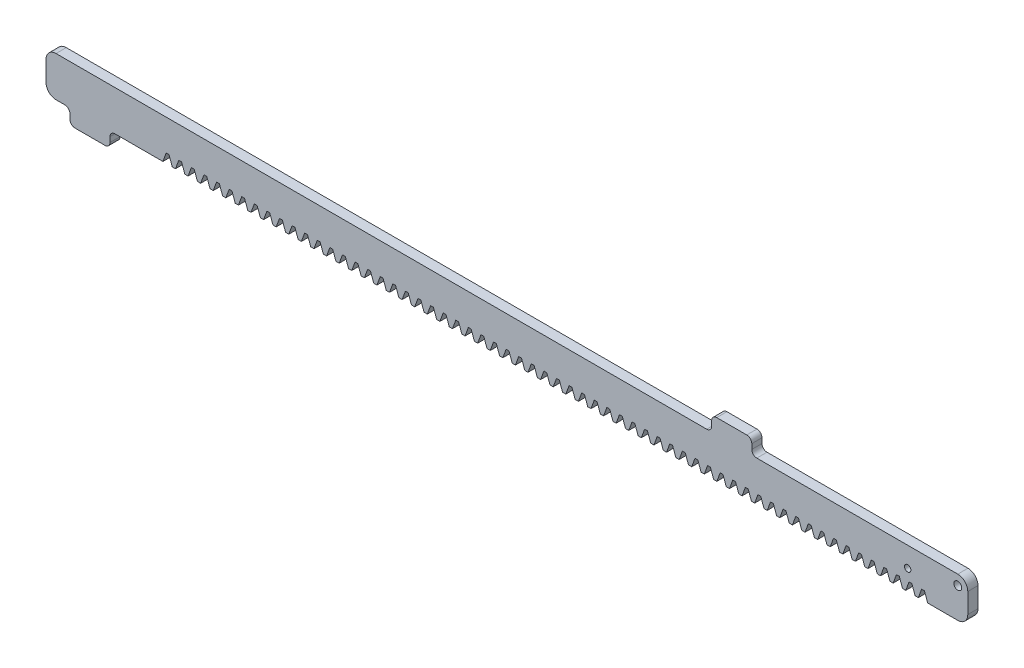
from build123d import *

# Parameters (mm, degrees)
SKETCH1_R           = 2.4892
BOSS_EXTRUDE1_DEPTH = 6.477
FILLET2_R           = 6.35
CUT_EXTRUDE1_DEPTH  = 586.278862726
LPATTERN1_COUNT     = 61
LPATTERN1_PITCH     = 7.979645331
SKETCH3_R           = 2.0193
CUT_EXTRUDE2_DEPTH  = 586.278862726
FILLET3_R           = 3.175


with BuildPart() as part:
    # Sketch1 → Boss-Extrude1 (new body)
    with BuildSketch(Plane.XY):
        Polygon((0, 25.4), (0, 0), (15.130665192, 0), (15.130665192, -9.525), (40.530665192, -9.525), (40.530665192, 0), (584.2, 0), (584.2, 25.4), (533.4, 25.4), (447.303292844, 25.4), (447.303292844, 34.925), (421.903292844, 34.925), (421.903292844, 25.4), (40.53078, 25.4), align=None)
        with Locations((577.85, 19.05)):
            Circle(SKETCH1_R, mode=Mode.SUBTRACT)
    extrude(amount=BOSS_EXTRUDE1_DEPTH)

    # Fillet2
    fillet2_edges = [part.edges().sort_by_distance(p)[0] for p in [
        (0, 0, 3.2385),
        (0, 25.4, 3.2385),
        (584.2, 25.4, 3.2385),
        (584.2, 0, 3.2385),
    ]]
    fillet(fillet2_edges, radius=FILLET2_R)

    # Sketch2 → Cut-Extrude1 (cut, through all)
    with BuildSketch(Plane.XY.offset(6.477)):
        Polygon((552.86876001, 0), (558.8, 0), (556.719910111, 5.715), (554.948849899, 5.715), align=None)
    cut_extrude1 = extrude(amount=-CUT_EXTRUDE1_DEPTH, mode=Mode.SUBTRACT)

    # LPattern1: Cut-Extrude1 ×61
    with Locations(*[(-i * LPATTERN1_PITCH, 0, 0) for i in range(1, LPATTERN1_COUNT)]):
        add(cut_extrude1, mode=Mode.SUBTRACT)

    # Sketch3 → Cut-Extrude2 (cut, through all)
    with BuildSketch(Plane.XY.offset(6.477)):
        with Locations((546.1, 12.7)):
            Circle(SKETCH3_R)
    extrude(amount=-CUT_EXTRUDE2_DEPTH, mode=Mode.SUBTRACT)

    # Fillet3
    fillet3_edges = [part.edges().sort_by_distance(p)[0] for p in [
        (421.903292844, 25.4, 3.2385),
        (421.903292844, 34.925, 3.2385),
        (447.303292844, 34.925, 3.2385),
        (447.303292844, 25.4, 3.2385),
        (40.530665192, -9.525, 3.2385),
        (40.530665192, 0, 3.2385),
        (15.130665192, -9.525, 3.2385),
        (15.130665192, 0, 3.2385),
    ]]
    fillet(fillet3_edges, radius=FILLET3_R)


solid = part.part
